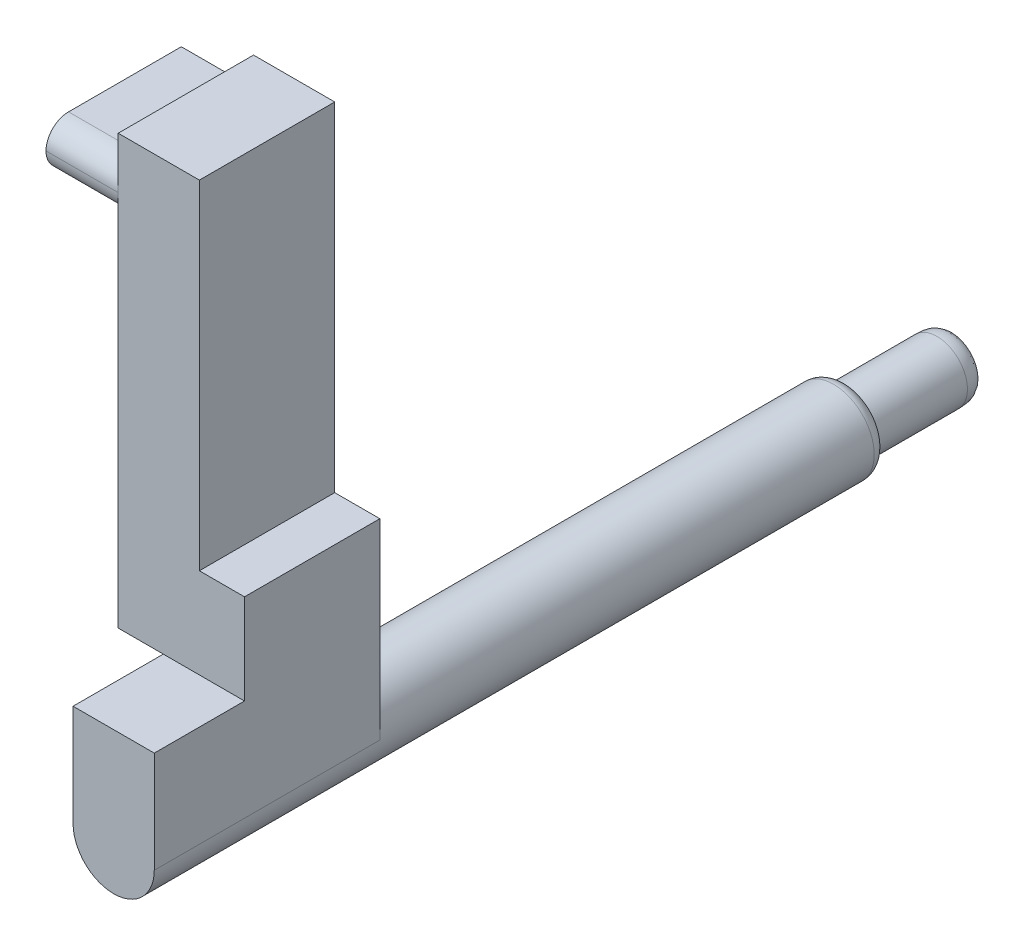
from build123d import *

# Parameters (mm, degrees)
CROQUIS1_R              = 0.675
SALIENTE_EXTRUIR1_DEPTH = 2.4
REDONDEO1_SIZE          = 0.4
CROQUIS2_R              = 0.9
SALIENTE_EXTRUIR2_DEPTH = 12.25
SALIENTE_EXTRUIR3_DEPTH = 2
CROQUIS4_W              = 1.8
CROQUIS4_H              = 2
SALIENTE_EXTRUIR4_DEPTH = 4.25
CROQUIS6_W              = 2
CROQUIS6_H              = 2
SALIENTE_EXTRUIR5_DEPTH = 1
CROQUIS7_W              = 1.8
CROQUIS7_H              = 2
SALIENTE_EXTRUIR6_DEPTH = 7.5
CROQUIS9_W              = 1.6
CROQUIS9_H              = 1
SALIENTE_EXTRUIR7_DEPTH = 2
REDONDEO2_START         = -9.897058824
REDONDEO2_DEPTH         = 1.6
SALIENTE_EXTRUIR8_START = 1
SALIENTE_EXTRUIR8_DEPTH = 1
SALIENTE_EXTRUIR9_DEPTH = 2
REDONDEO3_R             = 0.3


with BuildPart() as part:
    # Croquis1 → Saliente-Extruir1 (new body)
    with BuildSketch(Plane.XY):
        with Locations((-6.397058824, 9.575658077)):
            Circle(CROQUIS1_R)
    extrude(amount=-SALIENTE_EXTRUIR1_DEPTH)

    # Redondeo1
    # a fillet whose section is not a circle: 0.4 mm, written as the material it takes off along each edge
    with BuildSketch(Plane(origin=(-6.397058824, 9.575658077, -2.4), x_dir=(1, 0, 0), z_dir=(0, -1, 0))) as redondeo1_piece_1:
        with BuildLine():
            Bezier((0.675, REDONDEO1_SIZE), (0.675, 0), (0.675 - REDONDEO1_SIZE, 0), weights=[1, 1.414213562, 1])
            Line((0.675 - REDONDEO1_SIZE, 0), (0.675, 0))
            Line((0.675, 0), (0.675, REDONDEO1_SIZE))
        make_face()
    revolve(axis=Axis((-6.397058824, 9.575658077, -2.4), (0, 0, 1)), mode=Mode.SUBTRACT)

    # Croquis2 → Saliente-Extruir2 (add)
    with BuildSketch(Plane.XY):
        with Locations((-6.397058824, 9.575658077)):
            Circle(CROQUIS2_R)
    extrude(amount=SALIENTE_EXTRUIR2_DEPTH)

    # Croquis3 → Saliente-Extruir3 (add)
    with BuildSketch(Plane.XY.offset(12.25)):
        with BuildLine():
            Line((-5.497058824, 9.575658077), (-7.297058824, 9.575658077))
            ThreePointArc((-7.297058824, 9.575658077), (-6.397058824, 8.675658077), (-5.497058824, 9.575658077))
        make_face()
    extrude(amount=SALIENTE_EXTRUIR3_DEPTH)

    # Croquis4 → Saliente-Extruir4 (add)
    with BuildSketch(Plane(origin=(0, 9.575658077, 0), x_dir=(1, 0, 0), z_dir=(0, 1, 0))):
        with Locations((-6.397058824, -13.25)):
            Rectangle(CROQUIS4_W, CROQUIS4_H)
    extrude(amount=SALIENTE_EXTRUIR4_DEPTH)

    # Croquis6 → Saliente-Extruir5 (add)
    with BuildSketch(Plane.ZY.offset(7.297058824)):
        with Locations((13.25, 12.825658077)):
            Rectangle(CROQUIS6_W, CROQUIS6_H)
    extrude(amount=SALIENTE_EXTRUIR5_DEPTH)

    # Croquis7 → Saliente-Extruir6 (add)
    with BuildSketch(Plane(origin=(0, 13.825658077, 0), x_dir=(1, 0, 0), z_dir=(0, 1, 0))):
        with Locations((-7.397058824, -13.25)):
            Rectangle(CROQUIS7_W, CROQUIS7_H)
    extrude(amount=SALIENTE_EXTRUIR6_DEPTH)

    # Croquis9 → Saliente-Extruir7 (add)
    with BuildSketch(Plane(origin=(0, 0, 12.25), x_dir=(-1, 0, 0), z_dir=(0, 0, -1))):
        with Locations((9.097058824, 20.185658077)):
            Rectangle(CROQUIS9_W, CROQUIS9_H)
    extrude(amount=-SALIENTE_EXTRUIR7_DEPTH)

    # Redondeo2: read off the stored shape, not the designer's step
    # Redondeo2 outline → Redondeo2 (cut)
    with BuildSketch(Plane.YZ.offset(REDONDEO2_START)):
        with BuildLine():
            Line((19.685658077, 14.25), (19.685658077, 13.75))
            add(Edge.make_bspline(
                [(19.685658077, 13.75), (19.685658077, 14.25), (20.185658077, 14.25)],
                knots=[0, 0, 0, 1, 1, 1], degree=2, weights=[1, 0.707106781, 1]))
            Line((20.185658077, 14.25), (19.685658077, 14.25))
        make_face()
        with BuildLine():
            Line((20.685658077, 14.25), (20.185658077, 14.25))
            add(Edge.make_bspline(
                [(20.685658077, 13.75), (20.685658077, 14.25), (20.185658077, 14.25)],
                knots=[0, 0, 0, 1, 1, 1], degree=2, weights=[1, 0.707106781, 1]))
            Line((20.685658077, 13.75), (20.685658077, 14.25))
        make_face()
    extrude(amount=REDONDEO2_DEPTH, mode=Mode.SUBTRACT)

    # Croquis10 → Saliente-Extruir8 (add)
    with BuildSketch(Plane(origin=(0, 0, 12.25), x_dir=(-1, 0, 0), z_dir=(0, 0, -1)).offset(SALIENTE_EXTRUIR8_START)):
        with BuildLine():
            Line((7.297058824, 9.575658077), (7.297058824, 11.825658077))
            Line((7.297058824, 11.825658077), (8.297058824, 11.825658077))
            Line((8.297058824, 11.825658077), (8.297058824, 19.685658077))
            Line((8.297058824, 19.685658077), (9.897058824, 19.685658077))
            Line((9.897058824, 19.685658077), (9.897058824, 20.685658077))
            Line((9.897058824, 20.685658077), (8.297058824, 20.685658077))
            Line((8.297058824, 20.685658077), (8.297058824, 21.325658077))
            Line((8.297058824, 21.325658077), (6.497058824, 21.325658077))
            Line((6.497058824, 21.325658077), (6.497058824, 13.825658077))
            Line((6.497058824, 13.825658077), (5.497058824, 13.825658077))
            Line((5.497058824, 13.825658077), (5.497058824, 9.575658077))
            ThreePointArc((5.497058824, 9.575658077), (6.397058824, 10.475658077), (7.297058824, 9.575658077))
        make_face()
    extrude(amount=-SALIENTE_EXTRUIR8_DEPTH)

    # Croquis11 → Saliente-Extruir9 (add)
    with BuildSketch(Plane.XY.offset(14.25)):
        with BuildLine():
            Line((-7.297058824, 11.825658077), (-5.497058824, 11.825658077))
            Line((-5.497058824, 11.825658077), (-5.497058824, 9.575658077))
            ThreePointArc((-5.497058824, 9.575658077), (-6.397058824, 8.675658077), (-7.297058824, 9.575658077))
            Line((-7.297058824, 9.575658077), (-7.297058824, 11.825658077))
        make_face()
    extrude(amount=SALIENTE_EXTRUIR9_DEPTH)

    # Redondeo3
    # the kernel refuses this fillet: 0.3 mm, written as the material it takes off along each edge
    with BuildSketch(Plane(origin=(-6.397058824, 9.575658077, 0), x_dir=(1, 0, 0), z_dir=(0, -1, 0))) as redondeo3_piece_1:
        with BuildLine():
            CenterArc((0.6, 0.290473751), REDONDEO3_R, 284.477512185, 75.522487815)
            Line((0.675, 0), (0.6765, -0.005809475))
            ThreePointArc((0.6765, -0.005809475), (0.7875, -0.006), (0.9, -0.006))
            Line((0.9, -0.006), (0.906, 0))
            Line((0.906, 0), (0.906, 0.290473751))
            Line((0.906, 0.290473751), (0.9, 0.290473751))
        make_face()
    revolve(axis=Axis((-6.397058824, 9.575658077, 0), (0, 0, 1)), mode=Mode.SUBTRACT)


solid = part.part
